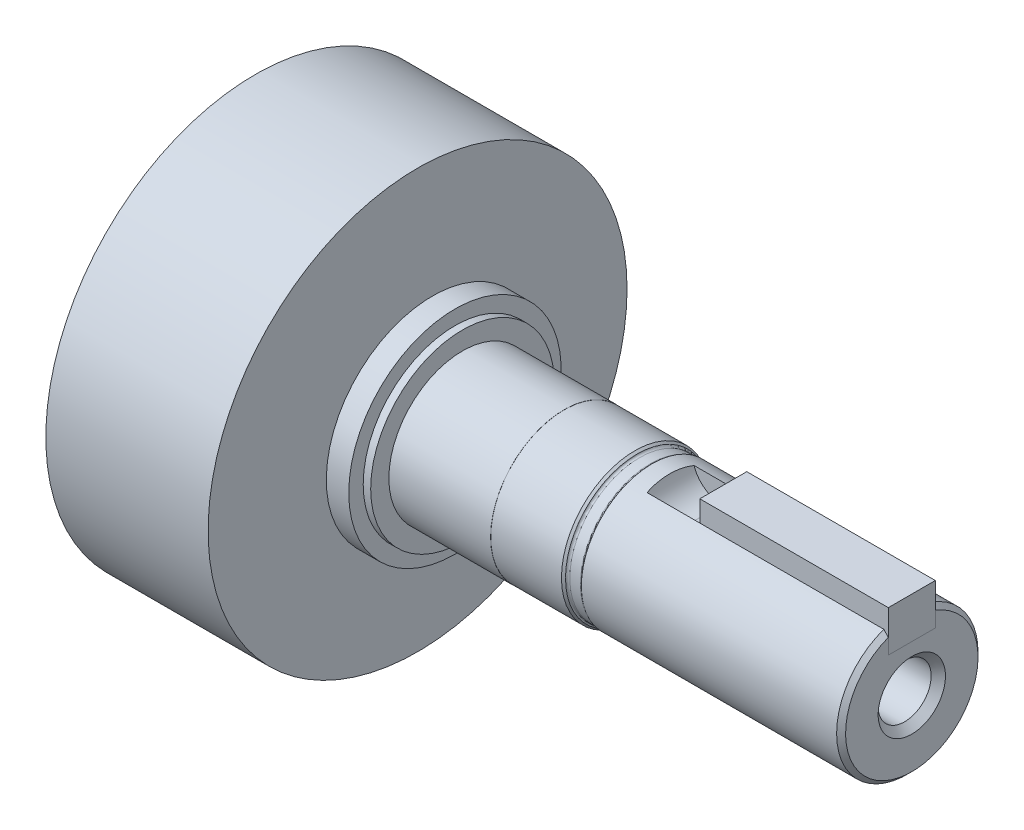
from build123d import *

# Parameters (mm, degrees)
SKETCH2_R                                           = 18.034
EXTRUDE1_DEPTH                                      = 83.8962
SKETCH5_W                                           = 59.0042
SKETCH5_H                                           = 0.0254
SKETCH12_W                                          = 46.6344
SKETCH12_H                                          = 0.4699
SKETCH13_W                                          = 2.54
SKETCH13_H                                          = 0.1778
CSK_FOR_M8_COUNTERSUNK_FLAT_HEAD_SCREW1_D           = 9
CSK_FOR_M8_COUNTERSUNK_FLAT_HEAD_SCREW1_DEPTH       = 19.05
CSK_FOR_M8_COUNTERSUNK_FLAT_HEAD_SCREW1_CSINK_D     = 11.43
CSK_FOR_M8_COUNTERSUNK_FLAT_HEAD_SCREW1_CSINK_ANGLE = 90
CSK_FOR_M8_COUNTERSUNK_FLAT_HEAD_SCREW1_TIP         = 2.703872786
CHAMFER3_SIZE                                       = 0.762
FILLET1_R                                           = 0.4064
EXTRUDE2_DEPTH                                      = 3.9878
SKETCH9_W                                           = 7.9756
SKETCH9_H                                           = 6.985
EXTRUDE3_DEPTH                                      = 32.004
CHAMFER1_SIZE                                       = 0.508
SKETCH10_R                                          = 35.56
EXTRUDE4_DEPTH                                      = 27.5463


with BuildPart() as part:
    # Sketch2 → Extrude1 (new body)
    with BuildSketch(Plane(origin=(0, 0, 0), x_dir=(0, 0, -1), z_dir=(1, 0, 0))):
        Circle(SKETCH2_R)
    extrude(amount=-EXTRUDE1_DEPTH)

    # Sketch3 → Cut-Revolve1 (revolve, cut)
    with BuildSketch(Plane.XY, mode=Mode.PRIVATE) as cut_revolve1_sk:
        Polygon((-83.8962, 8.4963), (-82.3722, 8.4963), (-82.3722, 8.3185), (-81.3562, 8.3185), (-81.3562, 18.034), (-83.8962, 18.034), align=None)
    revolve(cut_revolve1_sk.sketch.rotate(Axis((-83.8962, 0, 0), (1, 0, 0)), 180), axis=Axis((-83.8962, 0, 0), (1, 0, 0)), mode=Mode.SUBTRACT)

    # Sketch4 → Cut-Revolve2 (revolve, cut)
    with BuildSketch(Plane.XY, mode=Mode.PRIVATE) as cut_revolve2_sk:
        Polygon((-77.5462, 18.034), (-77.5462, 15.5829), (-76.2762, 15.5829), (-76.2762, 12.4968), (0, 12.4968), (0, 18.034), align=None)
    revolve(cut_revolve2_sk.sketch.rotate(Axis((-83.661895901, 0, 0), (1, 0, 0)), 90), axis=Axis((-83.661895901, 0, 0), (1, 0, 0)), mode=Mode.SUBTRACT)

    # Sketch5 → Cut-Revolve3 (revolve, cut)
    with BuildSketch(Plane.XY, mode=Mode.PRIVATE) as cut_revolve3_sk:
        with Locations((-29.5021, 12.4841)):
            Rectangle(SKETCH5_W, SKETCH5_H)
    revolve(cut_revolve3_sk.sketch.rotate(Axis((-76.2762, 0, 0), (1, 0, 0)), 90), axis=Axis((-76.2762, 0, 0), (1, 0, 0)), mode=Mode.SUBTRACT)

    # Sketch12 → Cut-Revolve4 (revolve, cut)
    with BuildSketch(Plane.XY, mode=Mode.PRIVATE) as cut_revolve4_sk:
        with Locations((-23.3172, 12.23645)):
            Rectangle(SKETCH12_W, SKETCH12_H)
    revolve(cut_revolve4_sk.sketch.rotate(Axis((-81.3562, 0, 0), (1, 0, 0)), 180), axis=Axis((-81.3562, 0, 0), (1, 0, 0)), mode=Mode.SUBTRACT)

    # Sketch13 → Cut-Revolve5 (revolve, cut)
    with BuildSketch(Plane.XY, mode=Mode.PRIVATE) as cut_revolve5_sk:
        with Locations((-45.3644, 11.9126)):
            Rectangle(SKETCH13_W, SKETCH13_H)
    revolve(cut_revolve5_sk.sketch.rotate(Axis((-77.5462, 0, 0), (1, 0, 0)), 180), axis=Axis((-77.5462, 0, 0), (1, 0, 0)), mode=Mode.SUBTRACT)

    # CSK for M8 Countersunk Flat Head Screw1
    with Locations(Plane(origin=(0, 0, 0), x_dir=(0, 0, 1), z_dir=(1, 0, 0))):
        with Locations((0, 0)):
            CounterSinkHole(CSK_FOR_M8_COUNTERSUNK_FLAT_HEAD_SCREW1_D / 2, CSK_FOR_M8_COUNTERSUNK_FLAT_HEAD_SCREW1_CSINK_D / 2, depth=CSK_FOR_M8_COUNTERSUNK_FLAT_HEAD_SCREW1_DEPTH, counter_sink_angle=CSK_FOR_M8_COUNTERSUNK_FLAT_HEAD_SCREW1_CSINK_ANGLE)
            with Locations((0, 0, -(CSK_FOR_M8_COUNTERSUNK_FLAT_HEAD_SCREW1_DEPTH + CSK_FOR_M8_COUNTERSUNK_FLAT_HEAD_SCREW1_TIP / 2))):  # 118° drill point
                Cone(0, CSK_FOR_M8_COUNTERSUNK_FLAT_HEAD_SCREW1_D / 2, CSK_FOR_M8_COUNTERSUNK_FLAT_HEAD_SCREW1_TIP, mode=Mode.SUBTRACT)

    # Chamfer3
    chamfer3_edges = [part.edges().sort_by_distance(p)[0] for p in [
        (0, 12.0015, 0),
    ]]
    chamfer(chamfer3_edges, length=CHAMFER3_SIZE)

    # Fillet1
    # the kernel refuses this fillet: 0.4064 mm, written as the material it adds along each edge
    with BuildSketch(Plane(origin=(-46.6344, 0, 0), x_dir=(0, -1, 0), z_dir=(0, 0, 1))) as fillet1_piece_1:
        with BuildLine():
            CenterArc((11.8237 + FILLET1_R, FILLET1_R), FILLET1_R, 180, 90)
            Line((11.8237 + FILLET1_R, 0), (11.8237 + FILLET1_R, -FILLET1_R * 0.02))
            Line((11.8237 + FILLET1_R, -FILLET1_R * 0.02), (11.8237 - FILLET1_R * 0.02, -FILLET1_R * 0.02))
            Line((11.8237 - FILLET1_R * 0.02, -FILLET1_R * 0.02), (11.8237 - FILLET1_R * 0.02, FILLET1_R))
            Line((11.8237 - FILLET1_R * 0.02, FILLET1_R), (11.8237, FILLET1_R))
        make_face()
    revolve(axis=Axis((-46.6344, 0, 0), (1, 0, 0)))
    with BuildSketch(Plane(origin=(-44.0944, 0, 0), x_dir=(0, -1, 0), z_dir=(0, 0, 1))) as fillet1_piece_2:
        with BuildLine():
            CenterArc((12.2301, -0.336010417), FILLET1_R, 124.228866328, 55.771133672)
            Line((11.8237, -0.336010417), (11.815572, -0.336010417))
            Line((11.815572, -0.336010417), (11.815572, 0))
            Line((11.815572, 0), (11.8237, 0.008128))
            ThreePointArc((11.8237, 0.008128), (11.9126, 0.008128), (11.996928, 0.006720208))
            Line((11.996928, 0.006720208), (12.0015, 0))
        make_face()
    revolve(axis=Axis((-44.0944, 0, 0), (1, 0, 0)))

    # Sketch8 → Extrude2 (cut, symmetric)
    with BuildSketch(Plane.XY):
        with BuildLine():
            Line((-41.1226, 12.0015), (0, 12.0015))
            Line((0, 12.0015), (0, 7.8994))
            Line((0, 7.8994), (-36.221930161, 7.8994))
            ThreePointArc((-36.221930161, 7.8994), (-39.417387455, 9.060272104), (-41.1226, 12.0015))
        make_face()
    extrude(amount=EXTRUDE2_DEPTH, both=True, mode=Mode.SUBTRACT)

    # Chamfer1
    chamfer1_edges = [part.edges().sort_by_distance(p)[0] for p in [
        (-83.8962, 8.4963, 0),
    ]]
    chamfer(chamfer1_edges, length=CHAMFER1_SIZE)

    # Chamfer2: read off the stored shape, not the designer's step
    # Chamfer2 outline → Chamfer2 (revolve, cut)
    with BuildSketch(Plane.YX):
        Polygon((12.2301, -46.627952603), (12.157996774, -46.627952603), (12.4714, -47.002908169), (12.4714, -46.6344), (12.2301, -46.6344), align=None)
    revolve(axis=Axis((0, 0, 0), (1, 0, 0)), mode=Mode.SUBTRACT)

    # Sketch10 → Extrude4 (add)
    with BuildSketch(Plane(origin=(-83.8962, 0, 0), x_dir=(0, 0, -1), z_dir=(1, 0, 0))):
        Circle(SKETCH10_R)
    extrude(amount=-EXTRUDE4_DEPTH)


with BuildPart() as body_2:
    # Sketch9 → Extrude3 (new body)
    with BuildSketch(Plane(origin=(0, 0, 0), x_dir=(0, 0, -1), z_dir=(1, 0, 0))):
        with Locations((0, 11.3919)):
            Rectangle(SKETCH9_W, SKETCH9_H)
    extrude(amount=-EXTRUDE3_DEPTH)


solid = Compound([part.part, body_2.part])
